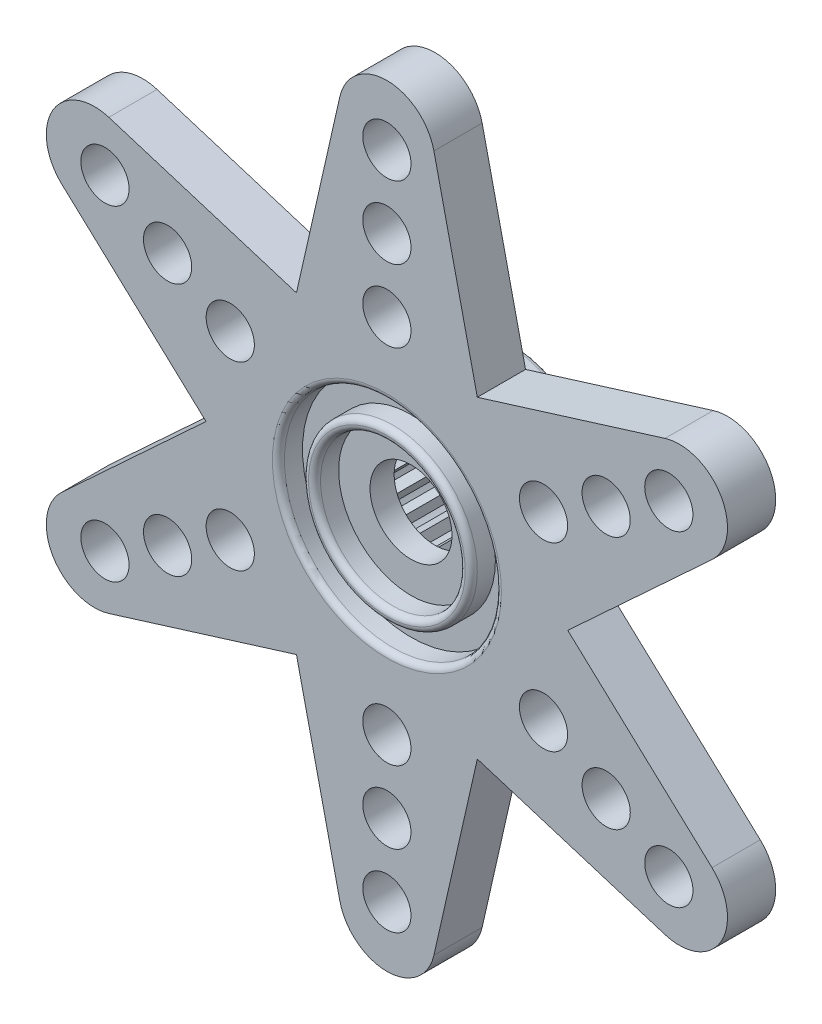
from build123d import *

# Parameters (mm, degrees)
ESQUISSE1_R                  = 4.25
ESQUISSE1_R_2                = 1.7
BOSS_EXTRU_1_DEPTH           = 5
ESQUISSE2_R                  = 3
ENL_V_MAT_EXTRU_1_DEPTH      = 3
BOSS_EXTRU_2_DEPTH           = 3
R_P_TITION_CIRCULAIRE1_DEPTH = 4
ESQUISSE4_R                  = 1
BOSS_EXTRU_3_DEPTH           = 2
R_P_TITION_CIRCULAIRE2_COUNT = 6
ENL_V_START                  = -1
ESQUISSE5_R                  = 3
ENL_V_MAT_EXTRU_2_DEPTH      = 1
CONG_1_R                     = 0.2
ESQUISSE6_R                  = 4.5
ESQUISSE6_R_2                = 3.5
ENL_V_MAT_EXTRU_3_DEPTH      = 1
CONG_2_R                     = 0.25
SCALE1_SCALE                 = 1.05


with BuildPart() as part:
    # Esquisse1 → Boss.-Extru.1 (new body)
    with BuildSketch(Plane.XY):
        Circle(ESQUISSE1_R)
        Circle(ESQUISSE1_R_2, mode=Mode.SUBTRACT)
    extrude(amount=BOSS_EXTRU_1_DEPTH)

    # Esquisse2 → Enlèv. mat.-Extru.1 (cut)
    with BuildSketch(Plane(origin=(0, 0, 0), x_dir=(-1, 0, 0), z_dir=(0, 0, -1))):
        Circle(ESQUISSE2_R)
    extrude(amount=-ENL_V_MAT_EXTRU_1_DEPTH, mode=Mode.SUBTRACT)

    # Esquisse3 → Boss.-Extru.2 (add)
    with BuildSketch(Plane(origin=(0, 0, 0), x_dir=(-1, 0, 0), z_dir=(0, 0, -1))):
        Polygon((-0.3, 3), (0, 2.6), (0.3, 3), align=None)
    extrude(amount=-BOSS_EXTRU_2_DEPTH)

    # Répétition circulaire1: read off the stored shape, not the designer's step
    # Répétition circulaire1 outline → Répétition circulaire1 (add)
    with BuildSketch(Plane.XY):
        with BuildLine():
            ThreePointArc((1.052468236, 2.80932565), (0.776457135, 2.897777479), (0.493198596, 2.959181499))
            Line((0.493198596, 2.959181499), (0.672929517, 2.511407148))
            Line((0.672929517, 2.511407148), (1.052468236, 2.80932565))
        make_face()
        with BuildLine():
            ThreePointArc((-0.493198596, 2.959181499), (-0.776457135, 2.897777479), (-1.052468236, 2.80932565))
            Line((-1.052468236, 2.80932565), (-0.672929517, 2.511407148))
            Line((-0.672929517, 2.511407148), (-0.493198596, 2.959181499))
        make_face()
        with BuildLine():
            ThreePointArc((-1.242285791, 2.730700645), (-1.5, 2.598076211), (-1.743713233, 2.441201376))
            Line((-1.743713233, 2.441201376), (-1.3, 2.25166605))
            Line((-1.3, 2.25166605), (-1.242285791, 2.730700645))
        make_face()
        with BuildLine():
            ThreePointArc((-1.906713263, 2.316127054), (-2.121320343, 2.121320343), (-2.316127054, 1.906713263))
            Line((-2.316127054, 1.906713263), (-1.838477631, 1.838477631))
            Line((-1.838477631, 1.838477631), (-1.906713263, 2.316127054))
        make_face()
        with BuildLine():
            ThreePointArc((-2.441201376, 1.743713233), (-2.598076211, 1.5), (-2.730700645, 1.242285791))
            Line((-2.730700645, 1.242285791), (-2.25166605, 1.3))
            Line((-2.25166605, 1.3), (-2.441201376, 1.743713233))
        make_face()
        with BuildLine():
            ThreePointArc((-2.809325651, 1.052468236), (-2.897777479, 0.776457135), (-2.959181499, 0.493198596))
            Line((-2.959181499, 0.493198596), (-2.511407148, 0.672929517))
            Line((-2.511407148, 0.672929517), (-2.809325651, 1.052468236))
        make_face()
        with BuildLine():
            ThreePointArc((-2.985999024, 0.289499268), (-3, 0), (-2.985999024, -0.289499268))
            Line((-2.985999024, -0.289499268), (-2.6, 0))
            Line((-2.6, 0), (-2.985999024, 0.289499268))
        make_face()
        with BuildLine():
            ThreePointArc((-2.959181499, -0.493198596), (-2.897777479, -0.776457135), (-2.809325651, -1.052468236))
            Line((-2.809325651, -1.052468236), (-2.511407148, -0.672929517))
            Line((-2.511407148, -0.672929517), (-2.959181499, -0.493198596))
        make_face()
        with BuildLine():
            ThreePointArc((-2.730700645, -1.242285791), (-2.598076211, -1.5), (-2.441201377, -1.743713233))
            Line((-2.441201377, -1.743713233), (-2.25166605, -1.3))
            Line((-2.25166605, -1.3), (-2.730700645, -1.242285791))
        make_face()
        with BuildLine():
            ThreePointArc((-2.316127055, -1.906713263), (-2.121320344, -2.121320344), (-1.906713263, -2.316127055))
            Line((-1.906713263, -2.316127055), (-1.838477631, -1.838477631))
            Line((-1.838477631, -1.838477631), (-2.316127055, -1.906713263))
        make_face()
        with BuildLine():
            ThreePointArc((-1.743713233, -2.441201377), (-1.5, -2.598076211), (-1.242285791, -2.730700645))
            Line((-1.242285791, -2.730700645), (-1.3, -2.25166605))
            Line((-1.3, -2.25166605), (-1.743713233, -2.441201377))
        make_face()
        with BuildLine():
            ThreePointArc((-1.052468236, -2.809325651), (-0.776457135, -2.897777479), (-0.493198596, -2.959181499))
            Line((-0.493198596, -2.959181499), (-0.672929517, -2.511407148))
            Line((-0.672929517, -2.511407148), (-1.052468236, -2.809325651))
        make_face()
        with BuildLine():
            ThreePointArc((-0.289499268, -2.985999024), (0, -3), (0.289499268, -2.985999024))
            Line((0.289499268, -2.985999024), (0, -2.6))
            Line((0, -2.6), (-0.289499268, -2.985999024))
        make_face()
        with BuildLine():
            ThreePointArc((0.493198596, -2.959181499), (0.776457135, -2.897777479), (1.052468236, -2.809325651))
            Line((1.052468236, -2.809325651), (0.672929517, -2.511407148))
            Line((0.672929517, -2.511407148), (0.493198596, -2.959181499))
        make_face()
        with BuildLine():
            ThreePointArc((1.242285791, -2.730700645), (1.5, -2.598076211), (1.743713233, -2.441201377))
            Line((1.743713233, -2.441201377), (1.3, -2.25166605))
            Line((1.3, -2.25166605), (1.242285791, -2.730700645))
        make_face()
        with BuildLine():
            ThreePointArc((1.906713263, -2.316127055), (2.121320344, -2.121320344), (2.316127055, -1.906713263))
            Line((2.316127055, -1.906713263), (1.838477631, -1.838477631))
            Line((1.838477631, -1.838477631), (1.906713263, -2.316127055))
        make_face()
        with BuildLine():
            ThreePointArc((2.441201377, -1.743713233), (2.598076211, -1.5), (2.730700645, -1.242285791))
            Line((2.730700645, -1.242285791), (2.25166605, -1.3))
            Line((2.25166605, -1.3), (2.441201377, -1.743713233))
        make_face()
        with BuildLine():
            ThreePointArc((2.809325651, -1.052468236), (2.897777479, -0.776457135), (2.959181499, -0.493198596))
            Line((2.959181499, -0.493198596), (2.511407148, -0.672929517))
            Line((2.511407148, -0.672929517), (2.809325651, -1.052468236))
        make_face()
        with BuildLine():
            ThreePointArc((2.985999024, -0.289499268), (3, 0), (2.985999024, 0.289499268))
            Line((2.985999024, 0.289499268), (2.6, 0))
            Line((2.6, 0), (2.985999024, -0.289499268))
        make_face()
        with BuildLine():
            ThreePointArc((2.959181499, 0.493198596), (2.897777479, 0.776457135), (2.809325651, 1.052468236))
            Line((2.809325651, 1.052468236), (2.511407148, 0.672929517))
            Line((2.511407148, 0.672929517), (2.959181499, 0.493198596))
        make_face()
        with BuildLine():
            ThreePointArc((2.730700645, 1.242285791), (2.598076211, 1.5), (2.441201376, 1.743713233))
            Line((2.441201376, 1.743713233), (2.25166605, 1.3))
            Line((2.25166605, 1.3), (2.730700645, 1.242285791))
        make_face()
        with BuildLine():
            ThreePointArc((2.316127054, 1.906713263), (2.121320343, 2.121320343), (1.906713263, 2.316127054))
            Line((1.906713263, 2.316127054), (1.838477631, 1.838477631))
            Line((1.838477631, 1.838477631), (2.316127054, 1.906713263))
        make_face()
        with BuildLine():
            ThreePointArc((1.743713233, 2.441201376), (1.5, 2.598076211), (1.242285791, 2.730700645))
            Line((1.242285791, 2.730700645), (1.3, 2.25166605))
            Line((1.3, 2.25166605), (1.743713233, 2.441201376))
        make_face()
    extrude(amount=R_P_TITION_CIRCULAIRE1_DEPTH)

    # Esquisse4 → Boss.-Extru.3 (add)
    with BuildSketch(Plane.XY.offset(5)):
        with BuildLine():
            Line((-1.95061736, 14.441692106), (-3.75, 6.495190528))
            Line((-3.75, 6.495190528), (-3.75, 2))
            Line((-3.75, 2), (0, 3.364888378))
            Line((0, 3.364888378), (3.75, 2))
            Line((3.75, 2), (3.75, 6.495190528))
            Line((3.75, 6.495190528), (1.95061736, 14.441692106))
            ThreePointArc((1.95061736, 14.441692106), (0, 16), (-1.95061736, 14.441692106))
        make_face()
        with Locations((0, 7.5)):
            Circle(ESQUISSE4_R, mode=Mode.SUBTRACT)
        with Locations((0, 10.5)):
            Circle(ESQUISSE4_R, mode=Mode.SUBTRACT)
        with Locations((0, 13.5)):
            Circle(ESQUISSE4_R, mode=Mode.SUBTRACT)
    boss_extru_3 = extrude(amount=-BOSS_EXTRU_3_DEPTH)

    # Répétition circulaire2: Boss.-Extru.3 ×6 about axis
    r_p_tition_circulaire2_axis = Axis((0, 0, 0), (0, 0, 1))
    for i in range(1, R_P_TITION_CIRCULAIRE2_COUNT):
        add(boss_extru_3.rotate(r_p_tition_circulaire2_axis, i * 360 / R_P_TITION_CIRCULAIRE2_COUNT))

    # Esquisse5 → Enlèv. mat.-Extru.2 (cut)
    with BuildSketch(Plane.XY.offset(5).offset(ENL_V_START)):
        Circle(ESQUISSE5_R)
    extrude(amount=ENL_V_MAT_EXTRU_2_DEPTH, mode=Mode.SUBTRACT)

    # Congé1
    cong_1_edges = [part.edges().sort_by_distance(p)[0] for p in [
        (-4.25, 0, 0),
    ]]
    fillet(cong_1_edges, radius=CONG_1_R)

    # Esquisse6 → Enlèv. mat.-Extru.3 (cut)
    with BuildSketch(Plane.XY.offset(5)):
        Circle(ESQUISSE6_R)
        Circle(ESQUISSE6_R_2, mode=Mode.SUBTRACT)
    extrude(amount=-ENL_V_MAT_EXTRU_3_DEPTH, mode=Mode.SUBTRACT)

    # Congé2
    cong_2_edges = [part.edges().sort_by_distance(p)[0] for p in [
        (-3, 0, 5),
        (-4.5, 0, 5),
        (-3.5, 0, 5),
    ]]
    fillet(cong_2_edges, radius=CONG_2_R - 0.0001)  # a hair under: the kernel refuses the full size


with BuildPart() as part_1:
    # Scale1: scaled about (0, 0, 3.681971043)
    add(part.part.scale(SCALE1_SCALE).moved(Location((0, 0, -0.184098552))))


solid = part_1.part
